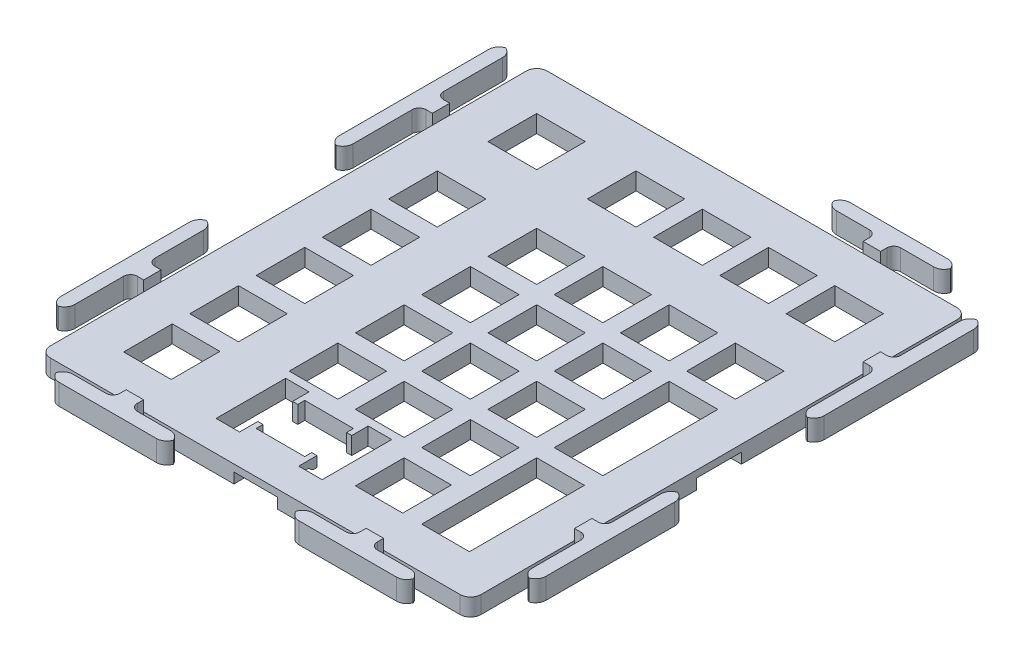
from build123d import *

# Parameters (mm, degrees)
SKETCH2_W           = 14
SKETCH2_H           = 14
SKETCH2_H_2         = 33.05
SKETCH2_W_2         = 13.729566143
SKETCH2_W_3         = 13.70712796
SKETCH2_W_4         = 13.572021081
BOSS_EXTRUDE1_DEPTH = 5
SKETCH4_W           = 12.525
SKETCH4_H           = 4.5
SKETCH4_W_2         = 4.5
SKETCH4_H_2         = 12.875
CUT_EXTRUDE1_DEPTH  = 105.356725069
BOSS_EXTRUDE2_DEPTH = 3
FILLET1_R           = 3
FILLET2_R           = 2
FILLET3_R           = 2
SKETCH6_W           = 4.5
SKETCH6_H           = 12.875
SKETCH6_W_2         = 12.525
SKETCH6_H_2         = 4.5
BOSS_EXTRUDE3_DEPTH = 2
FILLET10_R          = 3
FILLET13_R          = 2
FILLET14_R          = 3
FILLET15_R          = 2
FILLET16_R          = 3
FILLET17_R          = 2
FILLET18_R          = 3
FILLET19_R          = 2
FILLET20_R          = 3
FILLET22_R          = 3
FILLET23_R          = 2
FILLET24_R          = 3
CUT_EXTRUDE2_DEPTH  = 20
FILLET25_R          = 2


with BuildPart() as part:
    # Sketch2 → Boss-Extrude1 (new body)
    with BuildSketch(Plane(origin=(0, 0, 0), x_dir=(1, 0, 0), z_dir=(0, 1, 0))):
        Polygon((-50.855969028, -62.044409949), (43.049030972, -62.044409949), (58.009030972, -62.044409949), (58.009030972, -47.084409949), (58.009030972, 65.870590051), (58.009030972, 80.830590051), (43.049030972, 80.830590051), (-50.855969028, 80.830590051), (-65.815969028, 80.830590051), (-65.815969028, 65.870590051), (-65.815969028, -47.084409949), (-65.815969028, -62.044409949), align=None)
        with Locations((38.959030972, 61.745590051)):
            Rectangle(SKETCH2_W, SKETCH2_H, mode=Mode.SUBTRACT)
        with Locations((19.909030972, 61.745590051)):
            Rectangle(SKETCH2_W, SKETCH2_H, mode=Mode.SUBTRACT)
        with Locations((0.859030972, 61.745590051)):
            Rectangle(SKETCH2_W, SKETCH2_H, mode=Mode.SUBTRACT)
        with Locations((-18.190969028, 61.745590051)):
            Rectangle(SKETCH2_W, SKETCH2_H, mode=Mode.SUBTRACT)
        with Locations((38.959030972, 33.170590051)):
            Rectangle(SKETCH2_W, SKETCH2_H, mode=Mode.SUBTRACT)
        with Locations((-46.765969028, 61.745590051)):
            Rectangle(SKETCH2_W, SKETCH2_H, mode=Mode.SUBTRACT)
        with Locations((19.909030972, 33.170590051)):
            Rectangle(SKETCH2_W, SKETCH2_H, mode=Mode.SUBTRACT)
        with Locations((0.859030972, 33.170590051)):
            Rectangle(SKETCH2_W, SKETCH2_H, mode=Mode.SUBTRACT)
        with Locations((-18.190969028, 33.170590051)):
            Rectangle(SKETCH2_W, SKETCH2_H, mode=Mode.SUBTRACT)
        with Locations((-46.765969028, 33.170590051)):
            Rectangle(SKETCH2_W, SKETCH2_H, mode=Mode.SUBTRACT)
        with Locations((38.959030972, 4.595590051)):
            Rectangle(SKETCH2_W, SKETCH2_H_2, mode=Mode.SUBTRACT)
        with Locations((19.909030972, 14.120590051)):
            Rectangle(SKETCH2_W, SKETCH2_H, mode=Mode.SUBTRACT)
        with Locations((0.859030972, 14.120590051)):
            Rectangle(SKETCH2_W, SKETCH2_H, mode=Mode.SUBTRACT)
        with Locations((-18.190969028, 14.120590051)):
            Rectangle(SKETCH2_W, SKETCH2_H, mode=Mode.SUBTRACT)
        with Locations((-46.765969028, 14.120590051)):
            Rectangle(SKETCH2_W, SKETCH2_H, mode=Mode.SUBTRACT)
        with Locations((19.909030972, -4.929409949)):
            Rectangle(SKETCH2_W, SKETCH2_H, mode=Mode.SUBTRACT)
        with Locations((0.859030972, -4.929409949)):
            Rectangle(SKETCH2_W, SKETCH2_H, mode=Mode.SUBTRACT)
        with Locations((-18.190969028, -4.929409949)):
            Rectangle(SKETCH2_W, SKETCH2_H, mode=Mode.SUBTRACT)
        with Locations((-46.765969028, -4.929409949)):
            Rectangle(SKETCH2_W, SKETCH2_H, mode=Mode.SUBTRACT)
        with Locations((38.823814044, -33.504409949)):
            Rectangle(SKETCH2_W_2, SKETCH2_H_2, mode=Mode.SUBTRACT)
        with Locations((19.909030972, -23.979409949)):
            Rectangle(SKETCH2_W, SKETCH2_H, mode=Mode.SUBTRACT)
        with Locations((0.859030972, -23.979409949)):
            Rectangle(SKETCH2_W, SKETCH2_H, mode=Mode.SUBTRACT)
        with Locations((-18.190969028, -23.979409949)):
            Rectangle(SKETCH2_W, SKETCH2_H, mode=Mode.SUBTRACT)
        with Locations((-46.765969028, -23.979409949)):
            Rectangle(SKETCH2_W, SKETCH2_H, mode=Mode.SUBTRACT)
        with Locations((-46.912405048, -43.029409949)):
            Rectangle(SKETCH2_W_3, SKETCH2_H, mode=Mode.SUBTRACT)
        with Locations((19.695041513, -43.029409949)):
            Rectangle(SKETCH2_W_4, SKETCH2_H, mode=Mode.SUBTRACT)
        Polygon((-15.665969028, -36.029409949), (-1.665969028, -36.029409949), (-1.665969028, -38.029409949), (-0.165969028, -38.029409949), (-0.165969028, -33.279409949), (6.584030972, -33.279409949), (6.584030972, -53.279409949), (-0.165969028, -53.279409949), (-0.165969028, -48.029409949), (-1.665969028, -48.029409949), (-1.665969028, -50.029409949), (-15.665969028, -50.029409949), (-15.665969028, -48.029409949), (-17.165969028, -48.029409949), (-17.165969028, -53.279409949), (-23.915969028, -53.279409949), (-23.915969028, -33.279409949), (-17.165969028, -33.279409949), (-17.165969028, -38.029409949), (-15.665969028, -38.029409949), align=None, mode=Mode.SUBTRACT)
    extrude(amount=BOSS_EXTRUDE1_DEPTH)

    # Sketch4 → Cut-Extrude1 (cut, through all)
    with BuildSketch(Plane(origin=(0, 5, 0), x_dir=(1, 0, 0), z_dir=(0, 1, 0))):
        with Locations((-3.753469028, 78.580590051)):
            Rectangle(SKETCH4_W, SKETCH4_H)
        with Locations((-3.753469028, -59.794409949)):
            Rectangle(SKETCH4_W, SKETCH4_H)
        with Locations((55.759030972, 9.393090051)):
            Rectangle(SKETCH4_W_2, SKETCH4_H_2)
        with Locations((-63.565969028, 9.393090051)):
            Rectangle(SKETCH4_W_2, SKETCH4_H_2)
    extrude(amount=-CUT_EXTRUDE1_DEPTH, mode=Mode.SUBTRACT)

    # Sketch5 → Boss-Extrude2 (add, symmetric)
    with BuildSketch(Plane(origin=(0, 5, 0), x_dir=(1, 0, 0), z_dir=(0, 1, 0))):
        Polygon((-69.615969028, 55.802202747), (-65.815969028, 55.802202747), (-65.815969028, 50.802202747), (-69.615969028, 50.802202747), (-69.615969028, 28.802202747), (-73.615969028, 28.802202747), (-73.615969028, 77.802202747), (-69.615969028, 77.802202747), align=None)
        Polygon((28.009030972, -62.044409949), (33.009030972, -62.044409949), (33.009030972, -65.844409949), (47.509030972, -65.844409949), (47.509030972, -69.844409949), (13.509030972, -69.844409949), (13.509030972, -65.844409949), (28.009030972, -65.844409949), align=None)
        Polygon((33.016786021, 84.630590051), (47.516786021, 84.630590051), (47.516786021, 88.630590051), (13.516786021, 88.630590051), (13.516786021, 84.630590051), (28.016786021, 84.630590051), (28.016786021, 80.830590051), (33.016786021, 80.830590051), align=None)
        Polygon((-35.990838499, -65.844409949), (-21.490838499, -65.844409949), (-21.490838499, -69.844409949), (-55.490838499, -69.844409949), (-55.490838499, -65.844409949), (-40.990838499, -65.844409949), (-40.990838499, -62.044409949), (-35.990838499, -62.044409949), align=None)
        Polygon((-65.815969028, -27.197797253), (-69.615969028, -27.197797253), (-69.615969028, -8.197797253), (-73.615969028, -8.197797253), (-73.615969028, -51.197797253), (-69.615969028, -51.197797253), (-69.615969028, -32.197797253), (-65.815969028, -32.197797253), align=None)
        Polygon((61.809030972, 55.830590051), (61.809030972, 77.830590051), (65.809030972, 77.830590051), (65.809030972, 28.830590051), (61.809030972, 28.830590051), (61.809030972, 50.830590051), (58.009030972, 50.830590051), (58.009030972, 55.830590051), align=None)
        Polygon((58.009030972, -27.144409949), (61.809030972, -27.144409949), (61.809030972, -8.144409949), (65.809030972, -8.144409949), (65.809030972, -51.144409949), (61.809030972, -51.144409949), (61.809030972, -32.144409949), (58.009030972, -32.144409949), align=None)
    extrude(amount=BOSS_EXTRUDE2_DEPTH, both=True)

    # Fillet1
    # the kernel refuses this fillet: 3 mm, written as the material it takes off along each edge
    with BuildSketch(Plane(origin=(47.516786021, -5.5, -84.630590051), x_dir=(-1, 0, 0), z_dir=(0, 1, 0)), Plane(origin=(47.516786021, -5.5, -88.630590051), x_dir=(0, 0, 1), z_dir=(0, 1, 0)), Plane(origin=(13.516786021, -5.5, -88.630590051), x_dir=(1, 0, 0), z_dir=(0, 1, 0))) as fillet1_piece_1:
        with BuildLine():
            CenterArc((FILLET1_R, -FILLET1_R), FILLET1_R, 90, 90)
            Line((0, -FILLET1_R), (0, 0))
            Line((0, 0), (FILLET1_R, 0))
        make_face()
    extrude(amount=21, mode=Mode.SUBTRACT)
    with BuildSketch(Plane(origin=(13.516786021, -5.5, -84.630590051), x_dir=(1, 0, 0), z_dir=(0, 1, 0))) as fillet1_piece_2:
        with BuildLine():
            CenterArc((FILLET1_R, FILLET1_R), FILLET1_R, 180, 90)
            Line((0, FILLET1_R), (0, 0))
            Line((0, 0), (FILLET1_R, 0))
        make_face()
    extrude(amount=21, mode=Mode.SUBTRACT)

    # Fillet2
    fillet2_edges = [part.edges().sort_by_distance(p)[0] for p in [
        (33.016786021, 5, -84.630590051),
        (28.016786021, 5, -84.630590051),
    ]]
    fillet(fillet2_edges, radius=FILLET2_R)

    # Fillet3
    fillet3_edges = [part.edges().sort_by_distance(p)[0] for p in [
        (61.809030972, 5, -55.830590051),
        (61.809030972, 5, -50.830590051),
    ]]
    fillet(fillet3_edges, radius=FILLET3_R)

    # Sketch6 → Boss-Extrude3 (add)
    with BuildSketch(Plane(origin=(0, 5, 0), x_dir=(1, 0, 0), z_dir=(0, 1, 0))):
        with Locations((55.759030972, 9.393090051)):
            Rectangle(SKETCH6_W, SKETCH6_H)
        with Locations((-3.753469028, 78.580590051)):
            Rectangle(SKETCH6_W_2, SKETCH6_H_2)
        with Locations((-63.565969028, 9.393090051)):
            Rectangle(SKETCH6_W, SKETCH6_H)
        with Locations((-3.753469028, -59.794409949)):
            Rectangle(SKETCH6_W_2, SKETCH6_H_2)
    extrude(amount=-BOSS_EXTRUDE3_DEPTH)

    # Fillet10
    # the kernel refuses this fillet: 3 mm, written as the material it takes off along each edge
    with BuildSketch(Plane(origin=(65.809030972, 15.5, -77.830590051), x_dir=(0, 0, 1), z_dir=(0, -1, 0)), Plane(origin=(61.809030972, 15.5, -77.830590051), x_dir=(1, 0, 0), z_dir=(0, -1, 0)), Plane(origin=(65.809030972, 15.5, -28.830590051), x_dir=(-1, 0, 0), z_dir=(0, -1, 0)), Plane(origin=(61.809030972, 15.5, -28.830590051), x_dir=(0, 0, -1), z_dir=(0, -1, 0))) as fillet10_piece_1:
        with BuildLine():
            CenterArc((FILLET10_R, FILLET10_R), FILLET10_R, 180, 90)
            Line((0, FILLET10_R), (0, 0))
            Line((0, 0), (FILLET10_R, 0))
        make_face()
    extrude(amount=21, mode=Mode.SUBTRACT)

    # Fillet13
    fillet13_edges = [part.edges().sort_by_distance(p)[0] for p in [
        (61.809030972, 5, 32.144409949),
        (61.809030972, 5, 27.144409949),
    ]]
    fillet(fillet13_edges, radius=FILLET13_R)

    # Fillet14
    # the kernel refuses this fillet: 3 mm, written as the material it takes off along each edge
    with BuildSketch(Plane(origin=(61.809030972, 15.5, 51.144409949), x_dir=(0, 0, -1), z_dir=(0, -1, 0))) as fillet14_piece_1:
        with BuildLine():
            CenterArc((FILLET14_R, FILLET14_R), FILLET14_R, 180, 90)
            Line((0, FILLET14_R), (0, 0))
            Line((0, 0), (FILLET14_R, 0))
        make_face()
    extrude(amount=21, mode=Mode.SUBTRACT)
    with BuildSketch(Plane(origin=(65.809030972, 15.5, 51.144409949), x_dir=(0, 0, -1), z_dir=(0, -1, 0)), Plane(origin=(65.809030972, 15.5, 8.144409949), x_dir=(-1, 0, 0), z_dir=(0, -1, 0)), Plane(origin=(61.809030972, 15.5, 8.144409949), x_dir=(0, 0, 1), z_dir=(0, -1, 0))) as fillet14_piece_2:
        with BuildLine():
            CenterArc((FILLET14_R, -FILLET14_R), FILLET14_R, 90, 90)
            Line((0, -FILLET14_R), (0, 0))
            Line((0, 0), (FILLET14_R, 0))
        make_face()
    extrude(amount=21, mode=Mode.SUBTRACT)

    # Fillet15
    fillet15_edges = [part.edges().sort_by_distance(p)[0] for p in [
        (28.009030972, 5, 65.844409949),
        (33.009030972, 5, 65.844409949),
    ]]
    fillet(fillet15_edges, radius=FILLET15_R)

    # Fillet16
    # the kernel refuses this fillet: 3 mm, written as the material it takes off along each edge
    with BuildSketch(Plane(origin=(47.509030972, 15.5, 69.844409949), x_dir=(0, 0, -1), z_dir=(0, -1, 0)), Plane(origin=(47.509030972, 15.5, 65.844409949), x_dir=(-1, 0, 0), z_dir=(0, -1, 0)), Plane(origin=(13.509030972, 15.5, 69.844409949), x_dir=(1, 0, 0), z_dir=(0, -1, 0)), Plane(origin=(13.509030972, -5.5, 65.844409949), x_dir=(1, 0, 0), z_dir=(0, 1, 0))) as fillet16_piece_1:
        with BuildLine():
            CenterArc((FILLET16_R, -FILLET16_R), FILLET16_R, 90, 90)
            Line((0, -FILLET16_R), (0, 0))
            Line((0, 0), (FILLET16_R, 0))
        make_face()
    extrude(amount=21, mode=Mode.SUBTRACT)

    # Fillet17
    fillet17_edges = [part.edges().sort_by_distance(p)[0] for p in [
        (-35.990838499, 5, 65.844409949),
        (-40.990838499, 5, 65.844409949),
    ]]
    fillet(fillet17_edges, radius=FILLET17_R)

    # Fillet18
    # the kernel refuses this fillet: 3 mm, written as the material it takes off along each edge
    with BuildSketch(Plane(origin=(-21.490838499, 15.5, 69.844409949), x_dir=(0, 0, -1), z_dir=(0, -1, 0)), Plane(origin=(-21.490838499, 15.5, 65.844409949), x_dir=(-1, 0, 0), z_dir=(0, -1, 0)), Plane(origin=(-55.490838499, 15.5, 69.844409949), x_dir=(1, 0, 0), z_dir=(0, -1, 0)), Plane(origin=(-55.490838499, 15.5, 65.844409949), x_dir=(0, 0, 1), z_dir=(0, -1, 0))) as fillet18_piece_1:
        with BuildLine():
            CenterArc((FILLET18_R, -FILLET18_R), FILLET18_R, 90, 90)
            Line((0, -FILLET18_R), (0, 0))
            Line((0, 0), (FILLET18_R, 0))
        make_face()
    extrude(amount=21, mode=Mode.SUBTRACT)

    # Fillet19
    fillet19_edges = [part.edges().sort_by_distance(p)[0] for p in [
        (-69.615969028, 5, 27.197797253),
        (-69.615969028, 5, 32.197797253),
    ]]
    fillet(fillet19_edges, radius=FILLET19_R)

    # Fillet20
    # the kernel refuses this fillet: 3 mm, written as the material it takes off along each edge
    with BuildSketch(Plane(origin=(-69.615969028, -5.5, 8.197797253), x_dir=(0, 0, 1), z_dir=(0, 1, 0)), Plane(origin=(-73.615969028, -5.5, 8.197797253), x_dir=(1, 0, 0), z_dir=(0, 1, 0)), Plane(origin=(-73.615969028, -5.5, 51.197797253), x_dir=(0, 0, -1), z_dir=(0, 1, 0))) as fillet20_piece_1:
        with BuildLine():
            CenterArc((FILLET20_R, -FILLET20_R), FILLET20_R, 90, 90)
            Line((0, -FILLET20_R), (0, 0))
            Line((0, 0), (FILLET20_R, 0))
        make_face()
    extrude(amount=21, mode=Mode.SUBTRACT)
    with BuildSketch(Plane(origin=(-69.615969028, -5.5, 51.197797253), x_dir=(0, 0, -1), z_dir=(0, 1, 0))) as fillet20_piece_2:
        with BuildLine():
            CenterArc((FILLET20_R, FILLET20_R), FILLET20_R, 180, 90)
            Line((0, FILLET20_R), (0, 0))
            Line((0, 0), (FILLET20_R, 0))
        make_face()
    extrude(amount=21, mode=Mode.SUBTRACT)

    # Fillet22
    # the kernel refuses this fillet: 3 mm, written as the material it takes off along each edge
    with BuildSketch(Plane(origin=(-73.615969028, 15.5, -28.802202747), x_dir=(1, 0, 0), z_dir=(0, -1, 0)), Plane(origin=(-69.615969028, -5.5, -77.802202747), x_dir=(0, 0, 1), z_dir=(0, 1, 0)), Plane(origin=(-69.615969028, 15.5, -28.802202747), x_dir=(0, 0, -1), z_dir=(0, -1, 0))) as fillet22_piece_1:
        with BuildLine():
            CenterArc((FILLET22_R, -FILLET22_R), FILLET22_R, 90, 90)
            Line((0, -FILLET22_R), (0, 0))
            Line((0, 0), (FILLET22_R, 0))
        make_face()
    extrude(amount=21, mode=Mode.SUBTRACT)
    with BuildSketch(Plane(origin=(-73.615969028, -5.5, -77.802202747), x_dir=(0, 0, 1), z_dir=(0, 1, 0))) as fillet22_piece_2:
        with BuildLine():
            CenterArc((FILLET22_R, FILLET22_R), FILLET22_R, 180, 90)
            Line((0, FILLET22_R), (0, 0))
            Line((0, 0), (FILLET22_R, 0))
        make_face()
    extrude(amount=21, mode=Mode.SUBTRACT)

    # Fillet23
    fillet23_edges = [part.edges().sort_by_distance(p)[0] for p in [
        (-69.615969028, 5, -50.802202747),
        (-69.615969028, 5, -55.802202747),
    ]]
    fillet(fillet23_edges, radius=FILLET23_R)

    # Fillet24
    fillet24_edges = [part.edges().sort_by_distance(p)[0] for p in [
        (58.009030972, 2.5, 62.044409949),
        (-65.815969028, 2.5, 62.044409949),
        (-65.815969028, 2.5, -80.830590051),
        (58.009030972, 2.5, -80.830590051),
    ]]
    fillet(fillet24_edges, radius=FILLET24_R)

    # Sketch8 → Cut-Extrude2 (cut)
    with BuildSketch(Plane(origin=(-0.165969028, 0, 0), x_dir=(0, 0, -1), z_dir=(1, 0, 0))):
        Polygon((-53.279409949, 0), (-53.279409949, 3), (-50.279409949, 3), (-50.279409949, 2), (-48.029409949, 2), (-48.029409949, 0), align=None)
    extrude(amount=-CUT_EXTRUDE2_DEPTH, mode=Mode.SUBTRACT)

    # Fillet25
    # the kernel refuses this fillet: 2 mm, written as the material it takes off along each edge
    with BuildSketch(Plane(origin=(4.164157991, 2, 50.279409949), x_dir=(0, 1, 0), z_dir=(-1, 0, 0))) as fillet25_piece_1:
        with BuildLine():
            CenterArc((2, 1.732050808), FILLET25_R, 180, 60)
            Line((0, 1.732050808), (-0.04, 1.732050808))
            Line((-0.04, 1.732050808), (-0.04, 0))
            Line((-0.04, 0), (0, -0.04))
            ThreePointArc((0, -0.04), (0.5, -0.04), (0.98, -0.034641016))
            Line((0.98, -0.034641016), (1, 0))
        make_face()
    extrude(amount=25.660254038, mode=Mode.SUBTRACT)


solid = part.part
